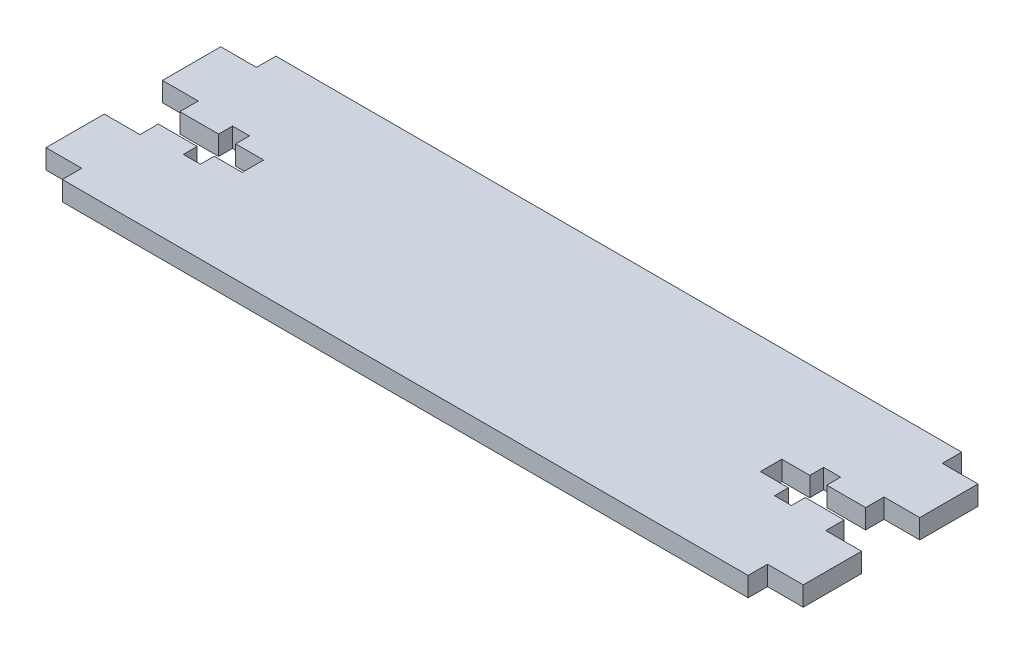
from build123d import *

# Parameters (mm, degrees)
BOSS_EXTRUDE1_DEPTH = 3.175
CUT_EXTRUDE1_DEPTH  = 65.406344311


with BuildPart() as part:
    # Sketch1 → Boss-Extrude1 (new body)
    with BuildSketch(Plane(origin=(0, 0, 0), x_dir=(1, 0, 0), z_dir=(0, 1, 0))):
        Polygon((56.0705, -17.4625), (-56.0705, -17.4625), (-56.0705, -14.2875), (-61.9125, -14.2875), (-61.9125, -4.7625), (-56.0705, -4.7625), (-56.0705, 4.7625), (-61.9125, 4.7625), (-61.9125, 14.2875), (-56.0705, 14.2875), (-56.0705, 17.4625), (56.0705, 17.4625), (56.0705, 14.2875), (61.9125, 14.2875), (61.9125, 4.7625), (56.0705, 4.7625), (56.0705, -4.7625), (61.9125, -4.7625), (61.9125, -14.2875), (56.0705, -14.2875), align=None)
    extrude(amount=BOSS_EXTRUDE1_DEPTH)

    # Sketch2 → Cut-Extrude1 (cut, through all)
    with BuildSketch(Plane(origin=(0, 3.175, 0), x_dir=(1, 0, 0), z_dir=(0, 1, 0))):
        Polygon((-49.7205, 1.7526), (-49.7205, 4.01875), (-46.942375, 4.01875), (-46.942375, 1.7526), (-42.3625, 1.7526), (-42.3625, -1.7526), (-46.942375, -1.7526), (-46.942375, -4.01875), (-49.7205, -4.01875), (-49.7205, -1.7526), (-56.0705, -1.7526), (-56.0705, 1.7526), align=None)
        Polygon((46.942375, 1.7526), (46.942375, 4.01875), (49.7205, 4.01875), (49.7205, 1.7526), (56.0705, 1.7526), (56.0705, -1.7526), (49.7205, -1.7526), (49.7205, -4.01875), (46.942375, -4.01875), (46.942375, -1.7526), (42.3625, -1.7526), (42.3625, 1.7526), align=None)
    extrude(amount=-CUT_EXTRUDE1_DEPTH, mode=Mode.SUBTRACT)


solid = part.part
